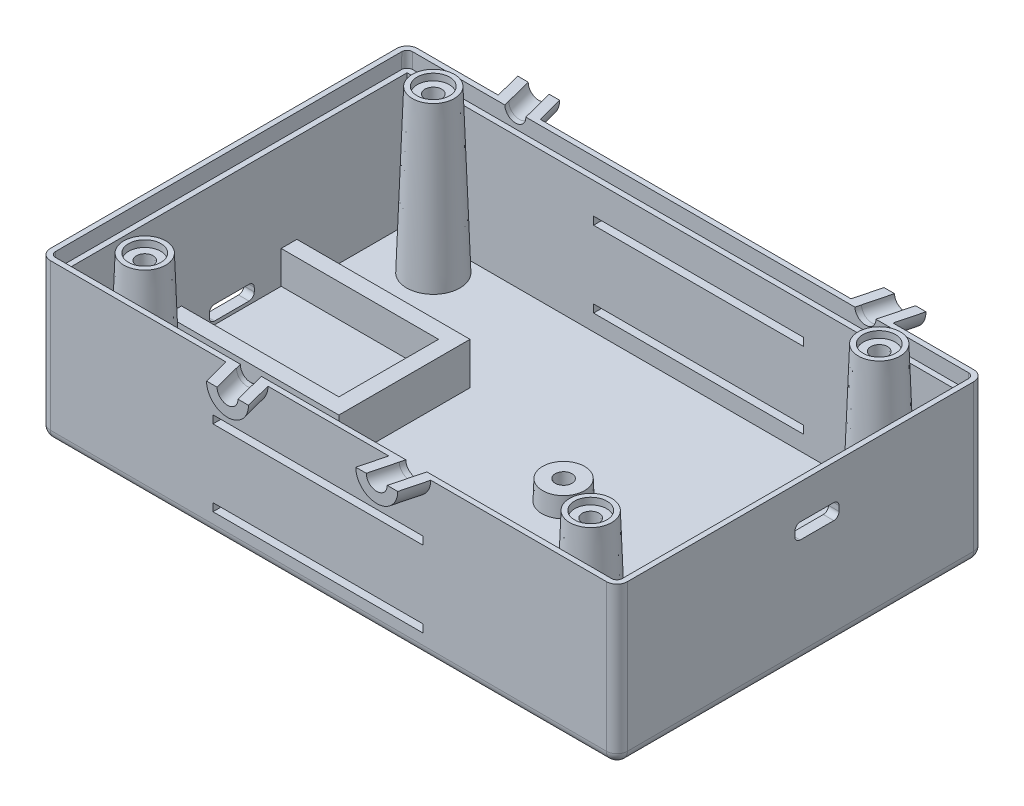
from build123d import *

# Parameters (mm, degrees)
BOSS_EXTRUDE1_DEPTH = 30
FILLET1_R           = 2
SHELL1_START        = -53
SHELL1_OUTLINE_W    = 28.000000000000004
SHELL1_OUTLINE_H    = 66
SHELL1_DEPTH        = 106
CUT_EXTRUDE1_DEPTH  = 3
CUT_EXTRUDE1_DRAFT  = 1.0000000000000022
CUT_EXTRUDE3_DEPTH  = 2
CUT_EXTRUDE4_DEPTH  = 2
SKETCH29_R          = 2.0000000000000036
SKETCH48_W          = 40
SKETCH48_H          = 1.5000000000000009
CUT_EXTRUDE5_DEPTH  = 5
SKETCH49_W          = 40
SKETCH49_H          = 1.5000000000000036
CUT_EXTRUDE6_DEPTH  = 5
SKETCH51_W          = 40
SKETCH51_H          = 1.5
CUT_EXTRUDE7_DEPTH  = 5
CUT_EXTRUDE8_DEPTH  = 5
BOSS_EXTRUDE2_DEPTH = 8
BOSS_EXTRUDE3_DEPTH = 1.75


# Read off the part's stored shape, not the designer's step: Shell1, Mounting Boss3, Mounting Boss4, Mounting Boss5, Mounting Boss6, Mounting Boss7
with BuildPart() as part:
    # Sketch2 → Boss-Extrude1 (new body)
    with BuildSketch(Plane(origin=(0, 0, 0), x_dir=(1, 0, 0), z_dir=(0, 1, 0))):
        Polygon((-55.000000000000014, 35), (54.99999999999999, 35), (55.00000000000001, -35), (-55, -35), align=None)
    extrude(amount=BOSS_EXTRUDE1_DEPTH)

    # Fillet1
    fillet1_edges = [part.edges().sort_by_distance(p)[0] for p in [
        (7.11e-15, 0, 35),
        (-55.00000000000001, 0, 0),
        (-1.421e-14, 0, -35),
        (55, 0, 0),
        (55.00000000000001, 15, 35),
        (-55, 15, 35),
        (-55.000000000000014, 15, -35),
        (54.99999999999999, 15, -35),
    ]]
    fillet(fillet1_edges, radius=FILLET1_R)

    # Shell1 outline → Shell1 (cut)
    with BuildSketch(Plane.YZ.offset(SHELL1_START)):
        with Locations((16, 0)):
            Rectangle(SHELL1_OUTLINE_W, SHELL1_OUTLINE_H)
    extrude(amount=SHELL1_DEPTH, mode=Mode.SUBTRACT)


with BuildPart() as cut_extrude1_tool:
    # Sketch4 → Cut-Extrude1 (with draft: the straight prism first)
    with BuildSketch(Plane(origin=(0, 30, 0), x_dir=(1, 0, 0), z_dir=(0, 1, 0))):
        with BuildLine():
            Line((54.00000000000001, -33), (54, 33))
            ThreePointArc((54, 33), (53.707106781186546, 33.707106781186546), (53, 34))
            Line((53, 34), (-53.000000000000014, 34))
            ThreePointArc((-53.000000000000014, 34), (-53.70710678118656, 33.707106781186546), (-54.000000000000014, 33))
            Line((-54.000000000000014, 33), (-54, -33))
            ThreePointArc((-54, -33), (-53.707106781186546, -33.707106781186546), (-53, -34))
            Line((-53, -34), (53.000000000000014, -34))
            ThreePointArc((53.000000000000014, -34), (53.70710678118656, -33.707106781186546), (54.00000000000001, -33))
        make_face()
    extrude(amount=-CUT_EXTRUDE1_DEPTH)
    # Cut-Extrude1: the draft: its side faces are tilted about the plane it starts from
    cut_extrude1_sides = [cut_extrude1_tool.faces().sort_by_distance(p)[0] for p in [
        (54, 28.5, 0),
        (53.707106781, 28.5, -33.707106781),
        (0, 28.5, -34),
        (-53.707106781, 28.5, -33.707106781),
        (-54, 28.5, 0),
        (-53.707106781, 28.5, 33.707106781),
        (0, 28.5, 34),
        (53.707106781, 28.5, 33.707106781),
    ]]
    draft(cut_extrude1_sides, Plane(origin=(0, 30, 0), x_dir=(1, 0, 0), z_dir=(0, 1, 0)), CUT_EXTRUDE1_DRAFT)


with BuildPart() as part_1:
    add(part.part)

    # Cut-Extrude1: cut by cut_extrude1_tool
    add(cut_extrude1_tool.part, mode=Mode.SUBTRACT)

    # Mounting Boss3 outline → Mounting Boss3 (revolve)
    with BuildSketch(Plane(origin=(42.5, 0, -27.5), x_dir=(1, 0, 0), z_dir=(0, 0, 1))):
        Polygon((4, 32.746), (3.093348776, 32.746), (3.060721118, 31.5), (1.6, 31.5), (1.538907273, 28), (0, 28), (0, 2), (5.073938557, 2), align=None)
    revolve(axis=Axis((42.5, 0, -27.5), (0, 1, 0)))

    # Mounting Boss4 outline → Mounting Boss4 (revolve)
    with BuildSketch(Plane(origin=(42.5, 0, 27.5), x_dir=(1, 0, 0), z_dir=(0, 0, 1))):
        Polygon((4, 32.746), (3.093348776, 32.746), (3.060721118, 31.5), (1.6, 31.5), (1.538907273, 28), (0, 28), (0, 2), (5.073938557, 2), align=None)
    revolve(axis=Axis((42.5, 0, 27.5), (0, 1, 0)))

    # Mounting Boss5 outline → Mounting Boss5 (revolve)
    with BuildSketch(Plane(origin=(-42.5, 0, -27.5), x_dir=(1, 0, 0), z_dir=(0, 0, 1))):
        Polygon((4, 32.746), (3.093348776, 32.746), (3.060721118, 31.5), (1.6, 31.5), (1.538907273, 28), (0, 28), (0, 2), (5.073938557, 2), align=None)
    revolve(axis=Axis((-42.5, 0, -27.5), (0, 1, 0)))

    # Mounting Boss6 outline → Mounting Boss6 (revolve)
    with BuildSketch(Plane(origin=(-42.5, 0, 27.5), x_dir=(1, 0, 0), z_dir=(0, 0, 1))):
        Polygon((4, 32.746), (3.093348776, 32.746), (3.060721118, 31.5), (1.6, 31.5), (1.538907273, 28), (0, 28), (0, 2), (5.073938557, 2), align=None)
    revolve(axis=Axis((-42.5, 0, 27.5), (0, 1, 0)))

    # Mounting Boss7 outline → Mounting Boss7 (revolve, cut)
    with BuildSketch(Plane(origin=(48.008201566, 0, 10.162400936), x_dir=(1, 0, 0), z_dir=(0, 0, 1))):
        Polygon((1.512899226, 1), (1.530354291, 2), (0, 2), (0, 1), align=None)
    mounting_boss7 = revolve(axis=Axis((48.008201566, 0, 10.162400936), (0, 1, 0)), mode=Mode.SUBTRACT)

    # Mounting Boss7 2 outline → Mounting Boss7 2 (revolve)
    with BuildSketch(Plane(origin=(48.008201566, 0, 10.162400936), x_dir=(1, 0, 0), z_dir=(0, 0, 1))):
        Polygon((4, 5.746), (1.595740964, 5.746), (1.530354291, 2), (4.130846305, 2), align=None)
    mounting_boss7_2 = revolve(axis=Axis((48.008201566, 0, 10.162400936), (0, 1, 0)))

    # Sketch-Pattern5: Mounting Boss7, Mounting Boss7 2 at 2 more places
    with Locations((-40.366, 0, -12.357001), (0, 0, -24.510002)):
        add(mounting_boss7, mode=Mode.SUBTRACT)
        add(mounting_boss7_2)

    # Sketch16 → Cut-Extrude3 (cut)
    with BuildSketch(Plane.ZY.offset(-53)):
        with BuildLine():
            Line((-7.333075850096779, 21.409749030000008), (-7.333075850096779, 22.38800558))
            ThreePointArc((-7.333075850096779, 22.38800558), (-7.040182631283326, 23.095112361186548), (-6.333075850096779, 23.38800558))
            Line((-6.333075850096779, 23.38800558), (0.06734967138067362, 23.38800558))
            ThreePointArc((0.06734967138067362, 23.38800558), (0.7744564525672212, 23.095112361186548), (1.0673496713806738, 22.38800558))
            Line((1.0673496713806738, 22.38800558), (1.0673496713806736, 21.409749030000008))
            ThreePointArc((1.0673496713806736, 21.409749030000008), (0.7744564525672213, 20.70264224881346), (0.06734967138067374, 20.409749030000008))
            Line((0.06734967138067374, 20.409749030000008), (-6.333075850096779, 20.409749030000008))
            ThreePointArc((-6.333075850096779, 20.409749030000008), (-7.040182631283326, 20.70264224881346), (-7.333075850096779, 21.409749030000008))
        make_face()
    extrude(amount=-CUT_EXTRUDE3_DEPTH, mode=Mode.SUBTRACT)

    # Sketch17 → Cut-Extrude4 (cut)
    with BuildSketch(Plane(origin=(-53.00000000000001, 0, 1.051e-14), x_dir=(-2e-16, 0, -1), z_dir=(1, 0, -2e-16))):
        with BuildLine():
            Line((-4.700909603162279, 5.37557361387065), (-4.700909603162279, 6.13625929820693))
            ThreePointArc((-4.700909603162279, 6.13625929820693), (-4.4080163843488265, 6.843366079393485), (-3.7009096031622715, 7.136259298206937))
            Line((-3.7009096031622715, 7.136259298206937), (2.8719039492320846, 7.136259298206937))
            ThreePointArc((2.8719039492320846, 7.136259298206937), (3.579010730418639, 6.843366079393485), (3.8719039492320917, 6.13625929820693))
            Line((3.8719039492320917, 6.13625929820693), (3.8719039492320917, 5.37557361387065))
            ThreePointArc((3.8719039492320917, 5.37557361387065), (3.579010730418639, 4.668466832684095), (2.8719039492320846, 4.3755736138706425))
            Line((2.8719039492320846, 4.3755736138706425), (-3.7009096031622715, 4.3755736138706425))
            ThreePointArc((-3.7009096031622715, 4.3755736138706425), (-4.4080163843488265, 4.668466832684095), (-4.700909603162279, 5.37557361387065))
        make_face()
    extrude(amount=-CUT_EXTRUDE4_DEPTH, mode=Mode.SUBTRACT)

    # Cut-Sweep2: sweep along a path in Sketch26
    with BuildLine(Plane(origin=(0, 30, 0), x_dir=(1, 0, 0), z_dir=(0, 1, 0))) as cut_sweep2_path:
        Line((34.91337388804527, 39.99999999999999), (0, -95))
        Line((0, -95), (-34.91337388804526, 39.99999999999999))
    # Sketch29 → Cut-Sweep2 (sweep, cut)
    with BuildSketch(Plane(origin=(0, 0, -40), x_dir=(-1, 0, 0), z_dir=(0, 0, -1))):
        with Locations((34.91337388804526, 30)):
            Circle(SKETCH29_R)
    sweep(path=cut_sweep2_path.line, transition=Transition.RIGHT, mode=Mode.SUBTRACT)

    # Sweep10: sweep along a path in Sketch35
    with BuildLine(Plane(origin=(0, 30, 0), x_dir=(1, 0, 0), z_dir=(0, 1, 0))) as sweep10_path:
        Line((33.62028596626583, 35), (34.91337388804527, 39.99999999999999))
    # Sketch34 → Sweep10 (sweep)
    with BuildSketch(Plane(origin=(0, 0, -35), x_dir=(-1, 0, 0), z_dir=(0, 0, -1))):
        with BuildLine():
            Line((-37.62028596626583, 30.000000000000004), (-35.62028596626583, 30.000000000000007))
            ThreePointArc((-35.62028596626583, 30.000000000000007), (-33.62028596626583, 27.999999999999996), (-31.62028596626583, 30.000000000000004))
            Line((-31.62028596626583, 30.000000000000004), (-29.62028596626583, 29.999999999999996))
            ThreePointArc((-29.62028596626583, 29.999999999999996), (-33.62028596626584, 25.999999999999996), (-37.62028596626583, 30.000000000000004))
        make_face()
    sweep(path=sweep10_path.line)

    # Sweep11: sweep along a path in Sketch37
    with BuildLine(Plane(origin=(0, 30, 0), x_dir=(1, 0, 0), z_dir=(0, 1, 0))) as sweep11_path:
        Line((-33.620285966265804, 35), (-34.91337388804526, 39.99999999999999))
    # Sketch36 → Sweep11 (sweep)
    with BuildSketch(Plane(origin=(0, 0, -35), x_dir=(-1, 0, 0), z_dir=(0, 0, -1))):
        with BuildLine():
            Line((29.6202859662658, 30), (31.6202859662658, 30.000000000000004))
            ThreePointArc((31.6202859662658, 30.000000000000004), (33.620285966265804, 27.999999999999996), (35.620285966265804, 30))
            Line((35.620285966265804, 30), (37.620285966265804, 30))
            ThreePointArc((37.620285966265804, 30), (33.620285966265804, 25.999999999999996), (29.6202859662658, 30))
        make_face()
    sweep(path=sweep11_path.line)

    # Sweep12: sweep along a path in Sketch39
    with BuildLine(Plane(origin=(0, 30, 0), x_dir=(1, 0, 0), z_dir=(0, 1, 0))) as sweep12_path:
        Line((-15.517055061353444, -35), (-14.223967139573995, -40))
    # Sketch38 → Sweep12 (sweep)
    with BuildSketch(Plane.XY.offset(35)):
        with BuildLine():
            Line((-19.51705506135345, 30.000000000000004), (-17.517055061353446, 30.000000000000007))
            ThreePointArc((-17.517055061353446, 30.000000000000007), (-15.517055061353446, 27.999999999999993), (-13.51705506135344, 30.000000000000004))
            Line((-13.51705506135344, 30.000000000000004), (-11.517055061353442, 29.999999999999996))
            ThreePointArc((-11.517055061353442, 29.999999999999996), (-15.517055061353448, 25.999999999999993), (-19.51705506135345, 30.000000000000004))
        make_face()
    sweep(path=sweep12_path.line)

    # Sweep14: sweep along a path in Sketch47
    with BuildLine(Plane(origin=(0, 30, 0), x_dir=(1, 0, 0), z_dir=(0, 1, 0))) as sweep14_path:
        Line((15.517055061353462, -35), (14.223967139574011, -40))
    # Sketch46 → Sweep14 (sweep)
    with BuildSketch(Plane.XY.offset(35)):
        with BuildLine():
            Line((11.517055061353458, 30), (13.517055061353457, 30))
            ThreePointArc((13.517055061353457, 30), (15.517055061353462, 27.999999999999993), (17.517055061353467, 30))
            Line((17.517055061353467, 30), (19.517055061353467, 30))
            ThreePointArc((19.517055061353467, 30), (15.517055061353462, 25.999999999999996), (11.517055061353458, 30))
        make_face()
    sweep(path=sweep14_path.line)

    # Sketch48 → Cut-Extrude5 (cut)
    with BuildSketch(Plane(origin=(0, 0, -35), x_dir=(-1, 0, 0), z_dir=(0, 0, -1))):
        with Locations((-2.5501994424348453, 5.858128431544458)):
            Rectangle(SKETCH48_W, SKETCH48_H)
    extrude(amount=-CUT_EXTRUDE5_DEPTH, mode=Mode.SUBTRACT)

    # Sketch49 → Cut-Extrude6 (cut)
    with BuildSketch(Plane(origin=(0, 0, -35), x_dir=(-1, 0, 0), z_dir=(0, 0, -1))):
        with Locations((-2.5501994424348453, 20.358128431544458)):
            Rectangle(SKETCH49_W, SKETCH49_H)
    extrude(amount=-CUT_EXTRUDE6_DEPTH, mode=Mode.SUBTRACT)

    # Sketch51 → Cut-Extrude7 (cut)
    with BuildSketch(Plane.XY.offset(35)):
        with Locations((-1.9972518043607401, 4.787724396603494)):
            Rectangle(SKETCH51_W, SKETCH51_H)
    extrude(amount=-CUT_EXTRUDE7_DEPTH, mode=Mode.SUBTRACT)

    # Sketch52 → Cut-Extrude8 (cut)
    with BuildSketch(Plane.XY.offset(35)):
        Polygon((-21.99725180436074, 20.037724396603497), (18.00274819563926, 20.037724396603494), (18.00274819563926, 18.53772439660349), (-21.99725180436074, 18.53772439660349), align=None)
    extrude(amount=-CUT_EXTRUDE8_DEPTH, mode=Mode.SUBTRACT)

    # Sketch54 → Boss-Extrude2 (add)
    with BuildSketch(Plane(origin=(0, 2, 0), x_dir=(1, 0, 0), z_dir=(0, 1, 0))):
        Polygon((-53.000000000000014, 9.000000000000002), (-23.000000000000007, 9.000000000000007), (-23.000000000000007, -9.999999999999991), (-53.00000000000001, -9.999999999999995), (-53.000000000000014, -12.999999999999998), (-20.00000000000001, -12.99999999999999), (-20.00000000000001, 12.000000000000005), (-53.000000000000014, 12), align=None)
    extrude(amount=BOSS_EXTRUDE2_DEPTH)

    # Sketch55 → Boss-Extrude3 (add)
    with BuildSketch(Plane(origin=(0, 2, 0), x_dir=(1, 0, 0), z_dir=(0, 1, 0))):
        Polygon((-23.000000000000007, -9.999999999999991), (-23.000000000000007, 9.000000000000007), (-53.00000000000001, 9.000000000000002), (-53.00000000000001, -9.999999999999995), align=None)
    extrude(amount=BOSS_EXTRUDE3_DEPTH)


solid = part_1.part
